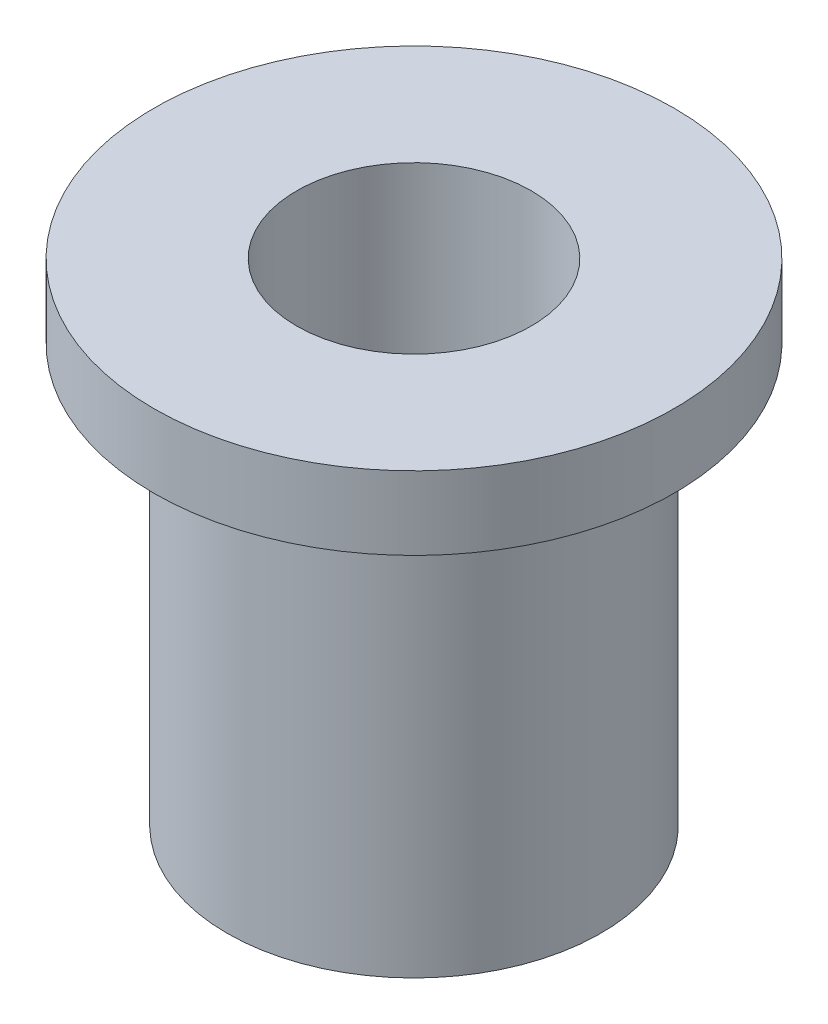
from build123d import *

# Parameters (mm, degrees)
SKETCH1_R           = 2.55
SKETCH1_R_2         = 1.6
BOSS_EXTRUDE1_DEPTH = 6.7
BOSS_EXTRUDE2_START = -1
SKETCH2_R           = 3.55
SKETCH2_R_2         = 1.6
BOSS_EXTRUDE2_DEPTH = 1


with BuildPart() as part:
    # Sketch1 → Boss-Extrude1 (new body)
    with BuildSketch(Plane(origin=(0, 0, 0), x_dir=(1, 0, 0), z_dir=(0, 1, 0))):
        Circle(SKETCH1_R)
        Circle(SKETCH1_R_2, mode=Mode.SUBTRACT)
    extrude(amount=BOSS_EXTRUDE1_DEPTH)

    # Sketch2 → Boss-Extrude2 (add)
    with BuildSketch(Plane(origin=(0, 6.7, 0), x_dir=(1, 0, 0), z_dir=(0, 1, 0)).offset(BOSS_EXTRUDE2_START)):
        Circle(SKETCH2_R)
        Circle(SKETCH2_R_2, mode=Mode.SUBTRACT)
    extrude(amount=BOSS_EXTRUDE2_DEPTH)


solid = part.part
